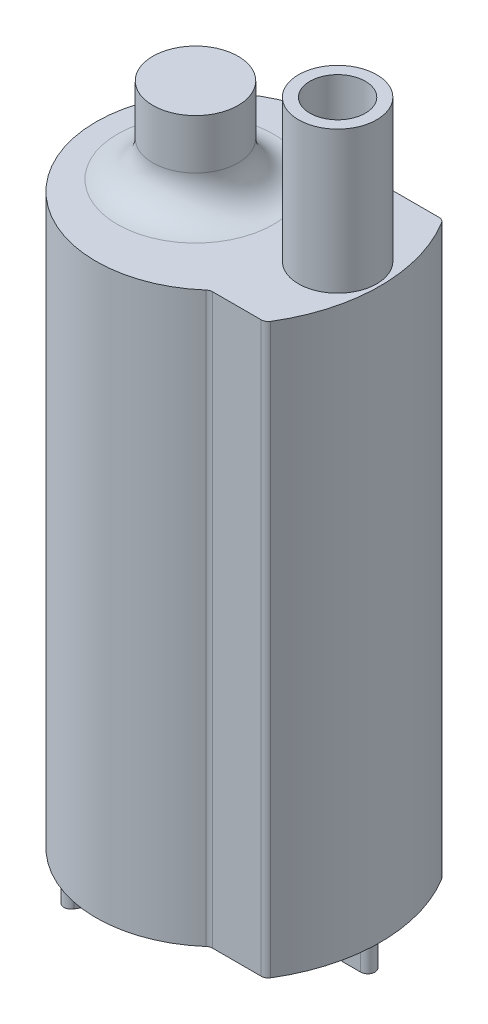
from build123d import *

# Parameters (mm, degrees)
BOSS_EXTRUDE1_DEPTH = 80
SKETCH2_R           = 5.5
SKETCH2_R_2         = 3.9
BOSS_EXTRUDE2_DEPTH = 20
SKETCH3_R           = 6
BOSS_EXTRUDE3_DEPTH = 12
FILLET1_R           = 5
BOSS_EXTRUDE4_DEPTH = 4
FILLET2_R           = 1


with BuildPart() as part:
    # Sketch1 → Boss-Extrude1 (new body)
    with BuildSketch(Plane(origin=(0, 0, 0), x_dir=(1, 0, 0), z_dir=(0, 1, 0))):
        with BuildLine():
            Line((11.521718622, 12.5), (19.306734576, 12.5))
            ThreePointArc((19.306734576, 12.5), (23, 0), (19.306734576, -12.5))
            Line((19.306734576, -12.5), (11.521718622, -12.5))
            ThreePointArc((11.521718622, -12.5), (-17, 0), (11.521718622, 12.5))
        make_face()
    extrude(amount=BOSS_EXTRUDE1_DEPTH)

    # Sketch2 → Boss-Extrude2 (add)
    with BuildSketch(Plane(origin=(0, 80, 0), x_dir=(1, 0, 0), z_dir=(0, 1, 0))):
        with Locations((17, 0)):
            Circle(SKETCH2_R)
        with Locations((17, 0)):
            Circle(SKETCH2_R_2, mode=Mode.SUBTRACT)
    extrude(amount=BOSS_EXTRUDE2_DEPTH)

    # Sketch3 → Boss-Extrude3 (add)
    with BuildSketch(Plane(origin=(0, 80, 0), x_dir=(1, 0, 0), z_dir=(0, 1, 0))):
        with Locations((-3, 0)):
            Circle(SKETCH3_R)
    extrude(amount=BOSS_EXTRUDE3_DEPTH)

    # Fillet1
    fillet1_edges = [part.edges().sort_by_distance(p)[0] for p in [
        (-9, 80, 0),
    ]]
    fillet(fillet1_edges, radius=FILLET1_R)

    # Sketch4 → Boss-Extrude4 (add)
    with BuildSketch(Plane.XZ):
        with BuildLine():
            Line((-7.116025404, 10.325317547), (-8.366025404, 12.490381057))
            ThreePointArc((-8.366025404, 12.490381057), (-8, 13.856406461), (-6.633974596, 13.490381057))
            Line((-6.633974596, 13.490381057), (-5.383974596, 11.325317547))
            ThreePointArc((-5.383974596, 11.325317547), (-5.75, 9.959292144), (-7.116025404, 10.325317547))
        make_face()
        with BuildLine():
            Line((-5.383974596, -11.325317547), (-6.633974596, -13.490381057))
            ThreePointArc((-6.633974596, -13.490381057), (-8, -13.856406461), (-8.366025404, -12.490381057))
            Line((-8.366025404, -12.490381057), (-7.116025404, -10.325317547))
            ThreePointArc((-7.116025404, -10.325317547), (-5.75, -9.959292144), (-5.383974596, -11.325317547))
        make_face()
        with BuildLine():
            Line((18.75, 1), (21.25, 1))
            ThreePointArc((21.25, 1), (22.25, 0), (21.25, -1))
            Line((21.25, -1), (18.75, -1))
            ThreePointArc((18.75, -1), (17.75, 0), (18.75, 1))
        make_face()
    extrude(amount=BOSS_EXTRUDE4_DEPTH)

    # Fillet2
    fillet2_edges = [part.edges().sort_by_distance(p)[0] for p in [
        (19.306734576, 40, -12.5),
        (11.521718622, 40, -12.5),
        (19.306734576, 40, 12.5),
        (11.521718622, 40, 12.5),
    ]]
    fillet(fillet2_edges, radius=FILLET2_R)


solid = part.part
